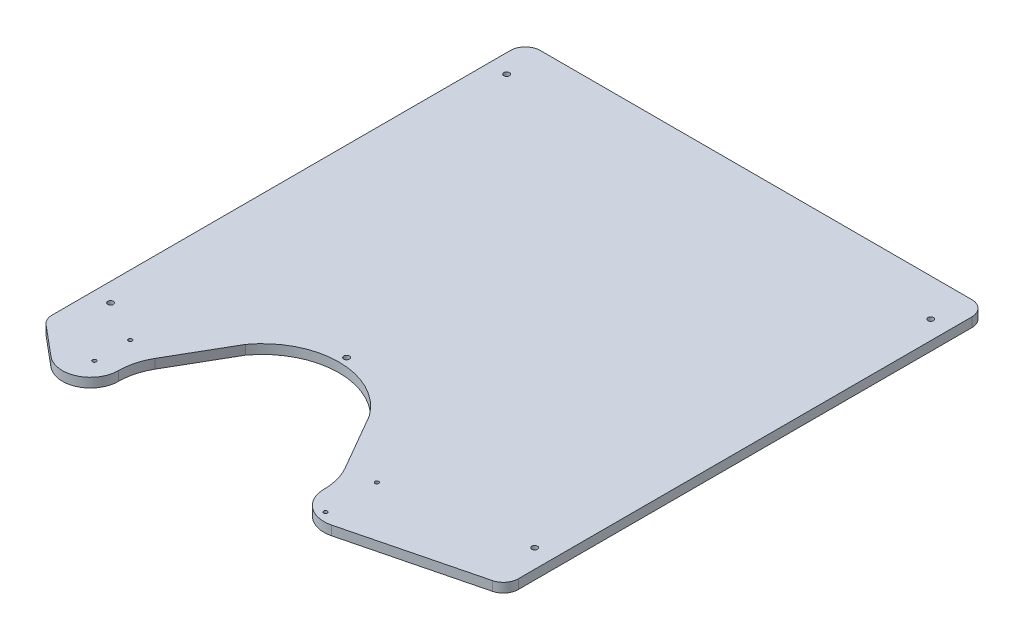
from build123d import *

# Parameters (mm, degrees)
ESQUISSE1_R             = 1
BOSS_EXTRU_1_DEPTH      = 5
ESQUISSE2_R             = 1.5
ENL_V_MAT_EXTRU_1_DEPTH = 275.48654739


with BuildPart() as part:
    # Esquisse1 → Boss.-Extru.1 (new body)
    with BuildSketch(Plane(origin=(0, 0, 0), x_dir=(1, 0, 0), z_dir=(0, 1, 0))):
        with BuildLine():
            Line((-115.5, 31.2), (115.5, 31.2))
            ThreePointArc((115.5, 31.2), (121.156854249, 28.856854249), (123.5, 23.2))
            Line((123.5, 23.2), (123.5, -219.563455357))
            ThreePointArc((123.5, -219.563455357), (121.809339782, -224.482015259), (117.451942122, -227.321671773))
            Line((117.451942122, -227.321671773), (48.659891479, -244.629528902))
            ThreePointArc((48.659891479, -244.629528902), (45.510605443, -245.074180006), (42.33836323, -244.8448408))
            ThreePointArc((42.33836323, -244.8448408), (33.490774319, -239.702526143), (30, -230.082873123))
            ThreePointArc((30, -230.082873123), (28.945508514, -222.073215083), (25.853895909, -214.609402001))
            Line((25.853895909, -214.609402001), (10.681549424, -188.330127019))
            Line((10.681549424, -188.330127019), (8.181549424, -184))
            ThreePointArc((8.181549424, -184), (-25, -167.082873123), (-58.181549424, -184))
            Line((-58.181549424, -184), (-60.681549424, -188.330127019))
            Line((-60.681549424, -188.330127019), (-75.853895909, -214.609402001))
            ThreePointArc((-75.853895909, -214.609402001), (-78.945508514, -222.073215083), (-80, -230.082873123))
            ThreePointArc((-80, -230.082873123), (-81.87001368, -237.335697347), (-87.013794564, -242.780137503))
            ThreePointArc((-87.013794564, -242.780137503), (-96.012583909, -245.048656558), (-104.623781388, -241.588646969))
            Line((-104.623781388, -241.588646969), (-120.632683407, -228.198311355))
            ThreePointArc((-120.632683407, -228.198311355), (-122.747808885, -225.448529171), (-123.5, -222.061898637))
            Line((-123.5, -222.061898637), (-123.5, 23.2))
            ThreePointArc((-123.5, 23.2), (-121.156854249, 28.856854249), (-115.5, 31.2))
        make_face()
        with Locations((41, -212.75)):
            Circle(ESQUISSE1_R, mode=Mode.SUBTRACT)
        with Locations((41, -240.25)):
            Circle(ESQUISSE1_R, mode=Mode.SUBTRACT)
        with Locations((-91, -212.75)):
            Circle(ESQUISSE1_R, mode=Mode.SUBTRACT)
        with Locations((-91, -232)):
            Circle(ESQUISSE1_R, mode=Mode.SUBTRACT)
    extrude(amount=-BOSS_EXTRU_1_DEPTH)

    # Esquisse2 → Enlèv. mat.-Extru.1 (cut, through all)
    with BuildSketch(Plane(origin=(0, 0, 0), x_dir=(1, 0, 0), z_dir=(0, 1, 0))):
        with Locations((-113.5, 11.2)):
            Circle(ESQUISSE2_R)
        with Locations((-25, -163)):
            Circle(ESQUISSE2_R)
        with Locations((113.5, 11.2)):
            Circle(ESQUISSE2_R)
        with Locations((113.5, -200.8)):
            Circle(ESQUISSE2_R)
        with Locations((-113.5, -200.8)):
            Circle(ESQUISSE2_R)
    extrude(amount=-ENL_V_MAT_EXTRU_1_DEPTH, mode=Mode.SUBTRACT)


solid = part.part
